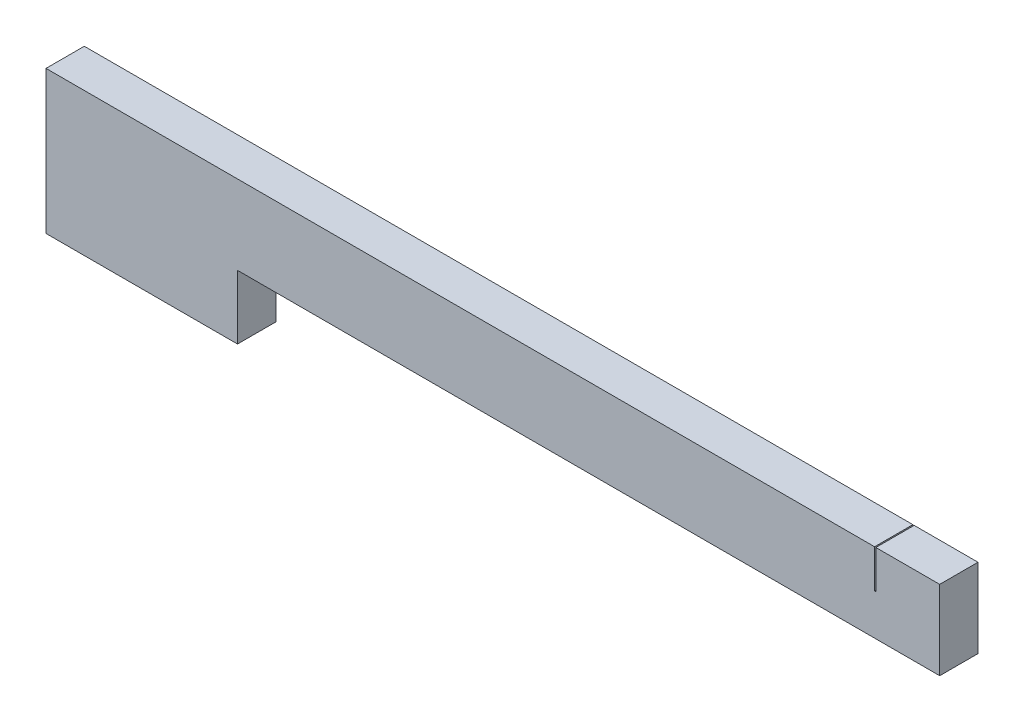
from build123d import *

# Parameters (mm, degrees)
BOSS_EXTRUDE1_DEPTH = 3
SKETCH3_W           = 0.1
SKETCH3_H           = 3
CUT_EXTRUDE1_DEPTH  = 3


with BuildPart() as part:
    # Sketch1 → Boss-Extrude1 (new body)
    with BuildSketch(Plane.XY):
        Polygon((0, 0), (0, 11.2), (70, 11.2), (70, 5), (15, 5), (15, 0), align=None)
    extrude(amount=BOSS_EXTRUDE1_DEPTH)

    # Sketch3 → Cut-Extrude1 (cut)
    with BuildSketch(Plane(origin=(0, 11.2, 0), x_dir=(1, 0, 0), z_dir=(0, 1, 0))):
        with Locations((64.95, -1.5)):
            Rectangle(SKETCH3_W, SKETCH3_H)
    extrude(amount=-CUT_EXTRUDE1_DEPTH, mode=Mode.SUBTRACT)


solid = part.part
